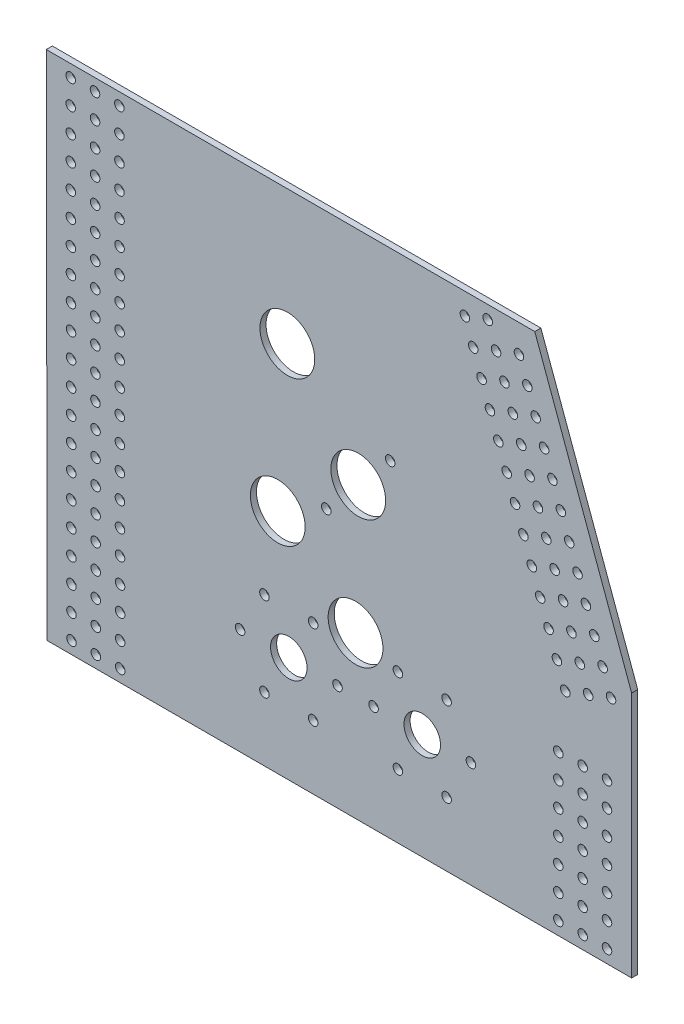
from build123d import *

# Parameters (mm, degrees)
SKETCH1_R           = 2.4892
SKETCH1_R_2         = 14.2875
SKETCH1_R_3         = 9.525
BOSS_EXTRUDE1_DEPTH = 3.175


with BuildPart() as part:
    # Sketch1 → Boss-Extrude1 (new body)
    with BuildSketch(Plane.XY):
        Polygon((-0.025125332, 266.699618316), (254.730760226, 266.699618316), (305.237685121, 128.677945558), (305.237685121, 0), (0.437227099, 0), align=None)
        with Locations((25.385902159, 260.349618316)):
            Circle(SKETCH1_R, mode=Mode.SUBTRACT)
        with Locations((38.085902159, 260.349618316)):
            Circle(SKETCH1_R, mode=Mode.SUBTRACT)
        with Locations((25.40791894, 247.6496374)):
            Circle(SKETCH1_R, mode=Mode.SUBTRACT)
        with Locations((125.682623504, 196.681006469)):
            Circle(SKETCH1_R_2, mode=Mode.SUBTRACT)
        with Locations((162.671805282, 151.462682403)):
            Circle(SKETCH1_R_2, mode=Mode.SUBTRACT)
        with Locations((120.691047365, 118.561346157)):
            Circle(SKETCH1_R_2, mode=Mode.SUBTRACT)
        with Locations((161.250919953, 83.906995565)):
            Circle(SKETCH1_R_2, mode=Mode.SUBTRACT)
        with Locations((38.10791894, 247.6496374)):
            Circle(SKETCH1_R, mode=Mode.SUBTRACT)
        with Locations((12.685902159, 260.349618316)):
            Circle(SKETCH1_R, mode=Mode.SUBTRACT)
        with Locations((25.429935721, 234.949656484)):
            Circle(SKETCH1_R, mode=Mode.SUBTRACT)
        with Locations((38.129935721, 234.949656484)):
            Circle(SKETCH1_R, mode=Mode.SUBTRACT)
        with Locations((25.451952502, 222.249675568)):
            Circle(SKETCH1_R, mode=Mode.SUBTRACT)
        with Locations((38.151952502, 222.249675568)):
            Circle(SKETCH1_R, mode=Mode.SUBTRACT)
        with Locations((25.473969283, 209.549694653)):
            Circle(SKETCH1_R, mode=Mode.SUBTRACT)
        with Locations((38.173969283, 209.549694653)):
            Circle(SKETCH1_R, mode=Mode.SUBTRACT)
        with Locations((25.495986064, 196.849713737)):
            Circle(SKETCH1_R, mode=Mode.SUBTRACT)
        with Locations((38.195986064, 196.849713737)):
            Circle(SKETCH1_R, mode=Mode.SUBTRACT)
        with Locations((25.518002845, 184.149732821)):
            Circle(SKETCH1_R, mode=Mode.SUBTRACT)
        with Locations((38.218002845, 184.149732821)):
            Circle(SKETCH1_R, mode=Mode.SUBTRACT)
        with Locations((25.540019625, 171.449751905)):
            Circle(SKETCH1_R, mode=Mode.SUBTRACT)
        with Locations((38.240019625, 171.449751905)):
            Circle(SKETCH1_R, mode=Mode.SUBTRACT)
        with Locations((25.562036406, 158.749770989)):
            Circle(SKETCH1_R, mode=Mode.SUBTRACT)
        with Locations((38.262036406, 158.749770989)):
            Circle(SKETCH1_R, mode=Mode.SUBTRACT)
        with Locations((25.584053187, 146.049790074)):
            Circle(SKETCH1_R, mode=Mode.SUBTRACT)
        with Locations((38.284053187, 146.049790074)):
            Circle(SKETCH1_R, mode=Mode.SUBTRACT)
        with Locations((25.606069968, 133.349809158)):
            Circle(SKETCH1_R, mode=Mode.SUBTRACT)
        with Locations((38.306069968, 133.349809158)):
            Circle(SKETCH1_R, mode=Mode.SUBTRACT)
        with Locations((25.628086749, 120.649828242)):
            Circle(SKETCH1_R, mode=Mode.SUBTRACT)
        with Locations((38.328086749, 120.649828242)):
            Circle(SKETCH1_R, mode=Mode.SUBTRACT)
        with Locations((25.65010353, 107.949847326)):
            Circle(SKETCH1_R, mode=Mode.SUBTRACT)
        with Locations((38.35010353, 107.949847326)):
            Circle(SKETCH1_R, mode=Mode.SUBTRACT)
        with Locations((25.672120311, 95.249866411)):
            Circle(SKETCH1_R, mode=Mode.SUBTRACT)
        with Locations((38.372120311, 95.249866411)):
            Circle(SKETCH1_R, mode=Mode.SUBTRACT)
        with Locations((25.694137092, 82.549885495)):
            Circle(SKETCH1_R, mode=Mode.SUBTRACT)
        with Locations((38.394137092, 82.549885495)):
            Circle(SKETCH1_R, mode=Mode.SUBTRACT)
        with Locations((25.716153872, 69.849904579)):
            Circle(SKETCH1_R, mode=Mode.SUBTRACT)
        with Locations((38.416153872, 69.849904579)):
            Circle(SKETCH1_R, mode=Mode.SUBTRACT)
        with Locations((25.738170653, 57.149923663)):
            Circle(SKETCH1_R, mode=Mode.SUBTRACT)
        with Locations((38.438170653, 57.149923663)):
            Circle(SKETCH1_R, mode=Mode.SUBTRACT)
        with Locations((25.760187434, 44.449942747)):
            Circle(SKETCH1_R, mode=Mode.SUBTRACT)
        with Locations((38.460187434, 44.449942747)):
            Circle(SKETCH1_R, mode=Mode.SUBTRACT)
        with Locations((25.782204215, 31.749961832)):
            Circle(SKETCH1_R, mode=Mode.SUBTRACT)
        with Locations((38.482204215, 31.749961832)):
            Circle(SKETCH1_R, mode=Mode.SUBTRACT)
        with Locations((25.804220996, 19.049980916)):
            Circle(SKETCH1_R, mode=Mode.SUBTRACT)
        with Locations((38.504220996, 19.049980916)):
            Circle(SKETCH1_R, mode=Mode.SUBTRACT)
        with Locations((25.826237777, 6.35)):
            Circle(SKETCH1_R, mode=Mode.SUBTRACT)
        with Locations((38.526237777, 6.35)):
            Circle(SKETCH1_R, mode=Mode.SUBTRACT)
        with Locations((12.70791894, 247.6496374)):
            Circle(SKETCH1_R, mode=Mode.SUBTRACT)
        with Locations((12.729935721, 234.949656484)):
            Circle(SKETCH1_R, mode=Mode.SUBTRACT)
        with Locations((12.751952502, 222.249675568)):
            Circle(SKETCH1_R, mode=Mode.SUBTRACT)
        with Locations((12.773969283, 209.549694653)):
            Circle(SKETCH1_R, mode=Mode.SUBTRACT)
        with Locations((12.795986064, 196.849713737)):
            Circle(SKETCH1_R, mode=Mode.SUBTRACT)
        with Locations((12.818002845, 184.149732821)):
            Circle(SKETCH1_R, mode=Mode.SUBTRACT)
        with Locations((12.840019625, 171.449751905)):
            Circle(SKETCH1_R, mode=Mode.SUBTRACT)
        with Locations((12.862036406, 158.749770989)):
            Circle(SKETCH1_R, mode=Mode.SUBTRACT)
        with Locations((12.884053187, 146.049790074)):
            Circle(SKETCH1_R, mode=Mode.SUBTRACT)
        with Locations((12.906069968, 133.349809158)):
            Circle(SKETCH1_R, mode=Mode.SUBTRACT)
        with Locations((12.928086749, 120.649828242)):
            Circle(SKETCH1_R, mode=Mode.SUBTRACT)
        with Locations((12.95010353, 107.949847326)):
            Circle(SKETCH1_R, mode=Mode.SUBTRACT)
        with Locations((12.972120311, 95.249866411)):
            Circle(SKETCH1_R, mode=Mode.SUBTRACT)
        with Locations((12.994137092, 82.549885495)):
            Circle(SKETCH1_R, mode=Mode.SUBTRACT)
        with Locations((13.016153872, 69.849904579)):
            Circle(SKETCH1_R, mode=Mode.SUBTRACT)
        with Locations((13.038170653, 57.149923663)):
            Circle(SKETCH1_R, mode=Mode.SUBTRACT)
        with Locations((13.060187434, 44.449942747)):
            Circle(SKETCH1_R, mode=Mode.SUBTRACT)
        with Locations((13.082204215, 31.749961832)):
            Circle(SKETCH1_R, mode=Mode.SUBTRACT)
        with Locations((13.104220996, 19.049980916)):
            Circle(SKETCH1_R, mode=Mode.SUBTRACT)
        with Locations((13.126237777, 6.35)):
            Circle(SKETCH1_R, mode=Mode.SUBTRACT)
        with Locations((218.267087279, 255.47586689)):
            Circle(SKETCH1_R, mode=Mode.SUBTRACT)
        with Locations((222.631425579, 243.549318722)):
            Circle(SKETCH1_R, mode=Mode.SUBTRACT)
        with Locations((226.995763878, 231.622770554)):
            Circle(SKETCH1_R, mode=Mode.SUBTRACT)
        with Locations((231.360102178, 219.696222386)):
            Circle(SKETCH1_R, mode=Mode.SUBTRACT)
        with Locations((235.724440477, 207.769674217)):
            Circle(SKETCH1_R, mode=Mode.SUBTRACT)
        with Locations((240.088778777, 195.843126049)):
            Circle(SKETCH1_R, mode=Mode.SUBTRACT)
        with Locations((244.453117077, 183.916577881)):
            Circle(SKETCH1_R, mode=Mode.SUBTRACT)
        with Locations((248.817455376, 171.990029713)):
            Circle(SKETCH1_R, mode=Mode.SUBTRACT)
        with Locations((253.181793676, 160.063481545)):
            Circle(SKETCH1_R, mode=Mode.SUBTRACT)
        with Locations((257.546131975, 148.136933377)):
            Circle(SKETCH1_R, mode=Mode.SUBTRACT)
        with Locations((261.910470275, 136.210385209)):
            Circle(SKETCH1_R, mode=Mode.SUBTRACT)
        with Locations((266.274808574, 124.28383704)):
            Circle(SKETCH1_R, mode=Mode.SUBTRACT)
        with Locations((270.639146874, 112.357288872)):
            Circle(SKETCH1_R, mode=Mode.SUBTRACT)
        with Locations((230.193635447, 259.840205189)):
            Circle(SKETCH1_R, mode=Mode.SUBTRACT)
        with Locations((246.484521915, 252.277995321)):
            Circle(SKETCH1_R, mode=Mode.SUBTRACT)
        with Locations((234.557973747, 247.913657021)):
            Circle(SKETCH1_R, mode=Mode.SUBTRACT)
        with Locations((238.922312046, 235.987108853)):
            Circle(SKETCH1_R, mode=Mode.SUBTRACT)
        with Locations((243.286650346, 224.060560685)):
            Circle(SKETCH1_R, mode=Mode.SUBTRACT)
        with Locations((247.650988646, 212.134012517)):
            Circle(SKETCH1_R, mode=Mode.SUBTRACT)
        with Locations((252.015326945, 200.207464349)):
            Circle(SKETCH1_R, mode=Mode.SUBTRACT)
        with Locations((256.379665245, 188.280916181)):
            Circle(SKETCH1_R, mode=Mode.SUBTRACT)
        with Locations((260.744003544, 176.354368013)):
            Circle(SKETCH1_R, mode=Mode.SUBTRACT)
        with Locations((265.108341844, 164.427819844)):
            Circle(SKETCH1_R, mode=Mode.SUBTRACT)
        with Locations((269.472680143, 152.501271676)):
            Circle(SKETCH1_R, mode=Mode.SUBTRACT)
        with Locations((273.837018443, 140.574723508)):
            Circle(SKETCH1_R, mode=Mode.SUBTRACT)
        with Locations((278.201356743, 128.64817534)):
            Circle(SKETCH1_R, mode=Mode.SUBTRACT)
        with Locations((282.565695042, 116.721627172)):
            Circle(SKETCH1_R, mode=Mode.SUBTRACT)
        with Locations((250.848860215, 240.351447153)):
            Circle(SKETCH1_R, mode=Mode.SUBTRACT)
        with Locations((255.213198514, 228.424898985)):
            Circle(SKETCH1_R, mode=Mode.SUBTRACT)
        with Locations((259.577536814, 216.498350817)):
            Circle(SKETCH1_R, mode=Mode.SUBTRACT)
        with Locations((263.941875113, 204.571802648)):
            Circle(SKETCH1_R, mode=Mode.SUBTRACT)
        with Locations((268.306213413, 192.64525448)):
            Circle(SKETCH1_R, mode=Mode.SUBTRACT)
        with Locations((272.670551712, 180.718706312)):
            Circle(SKETCH1_R, mode=Mode.SUBTRACT)
        with Locations((277.034890012, 168.792158144)):
            Circle(SKETCH1_R, mode=Mode.SUBTRACT)
        with Locations((281.399228312, 156.865609976)):
            Circle(SKETCH1_R, mode=Mode.SUBTRACT)
        with Locations((285.763566611, 144.939061808)):
            Circle(SKETCH1_R, mode=Mode.SUBTRACT)
        with Locations((290.127904911, 133.01251364)):
            Circle(SKETCH1_R, mode=Mode.SUBTRACT)
        with Locations((294.49224321, 121.085965471)):
            Circle(SKETCH1_R, mode=Mode.SUBTRACT)
        with Locations((266.993755407, 82.990221112)):
            Circle(SKETCH1_R, mode=Mode.SUBTRACT)
        with Locations((279.693755407, 82.990221112)):
            Circle(SKETCH1_R, mode=Mode.SUBTRACT)
        with Locations((292.393755407, 82.990221112)):
            Circle(SKETCH1_R, mode=Mode.SUBTRACT)
        with Locations((279.693755407, 70.290221112)):
            Circle(SKETCH1_R, mode=Mode.SUBTRACT)
        with Locations((292.393755407, 70.290221112)):
            Circle(SKETCH1_R, mode=Mode.SUBTRACT)
        with Locations((279.693755407, 57.590221112)):
            Circle(SKETCH1_R, mode=Mode.SUBTRACT)
        with Locations((292.393755407, 57.590221112)):
            Circle(SKETCH1_R, mode=Mode.SUBTRACT)
        with Locations((279.693755407, 44.890221112)):
            Circle(SKETCH1_R, mode=Mode.SUBTRACT)
        with Locations((292.393755407, 44.890221112)):
            Circle(SKETCH1_R, mode=Mode.SUBTRACT)
        with Locations((279.693755407, 32.190221112)):
            Circle(SKETCH1_R, mode=Mode.SUBTRACT)
        with Locations((292.393755407, 32.190221112)):
            Circle(SKETCH1_R, mode=Mode.SUBTRACT)
        with Locations((279.693755407, 19.490221112)):
            Circle(SKETCH1_R, mode=Mode.SUBTRACT)
        with Locations((292.393755407, 19.490221112)):
            Circle(SKETCH1_R, mode=Mode.SUBTRACT)
        with Locations((279.693755407, 6.790221112)):
            Circle(SKETCH1_R, mode=Mode.SUBTRACT)
        with Locations((292.393755407, 6.790221112)):
            Circle(SKETCH1_R, mode=Mode.SUBTRACT)
        with Locations((266.993755407, 70.290221112)):
            Circle(SKETCH1_R, mode=Mode.SUBTRACT)
        with Locations((266.993755407, 57.590221112)):
            Circle(SKETCH1_R, mode=Mode.SUBTRACT)
        with Locations((266.993755407, 44.890221112)):
            Circle(SKETCH1_R, mode=Mode.SUBTRACT)
        with Locations((266.993755407, 32.190221112)):
            Circle(SKETCH1_R, mode=Mode.SUBTRACT)
        with Locations((266.993755407, 19.490221112)):
            Circle(SKETCH1_R, mode=Mode.SUBTRACT)
        with Locations((266.993755407, 6.790221112)):
            Circle(SKETCH1_R, mode=Mode.SUBTRACT)
        with Locations((196.048919953, 55.341109974)):
            Circle(SKETCH1_R_3, mode=Mode.SUBTRACT)
        with Locations((126.452919953, 55.341109974)):
            Circle(SKETCH1_R_3, mode=Mode.SUBTRACT)
        with Locations((221.448919953, 55.341109974)):
            Circle(SKETCH1_R, mode=Mode.SUBTRACT)
        with Locations((208.748919953, 33.344064718)):
            Circle(SKETCH1_R, mode=Mode.SUBTRACT)
        with Locations((183.348919953, 33.344064718)):
            Circle(SKETCH1_R, mode=Mode.SUBTRACT)
        with Locations((170.648919953, 55.341109974)):
            Circle(SKETCH1_R, mode=Mode.SUBTRACT)
        with Locations((183.348919953, 77.33815523)):
            Circle(SKETCH1_R, mode=Mode.SUBTRACT)
        with Locations((208.748919953, 77.33815523)):
            Circle(SKETCH1_R, mode=Mode.SUBTRACT)
        with Locations((101.052919953, 55.341109974)):
            Circle(SKETCH1_R, mode=Mode.SUBTRACT)
        with Locations((113.752919953, 77.33815523)):
            Circle(SKETCH1_R, mode=Mode.SUBTRACT)
        with Locations((139.152919953, 77.33815523)):
            Circle(SKETCH1_R, mode=Mode.SUBTRACT)
        with Locations((151.852919953, 55.341109974)):
            Circle(SKETCH1_R, mode=Mode.SUBTRACT)
        with Locations((139.152919953, 33.344064718)):
            Circle(SKETCH1_R, mode=Mode.SUBTRACT)
        with Locations((113.752919953, 33.344064718)):
            Circle(SKETCH1_R, mode=Mode.SUBTRACT)
        with Locations((179.316423254, 170.656016636)):
            Circle(SKETCH1_R, mode=Mode.SUBTRACT)
        with Locations((146.013408676, 132.295239531)):
            Circle(SKETCH1_R, mode=Mode.SUBTRACT)
    extrude(amount=BOSS_EXTRUDE1_DEPTH)


solid = part.part
